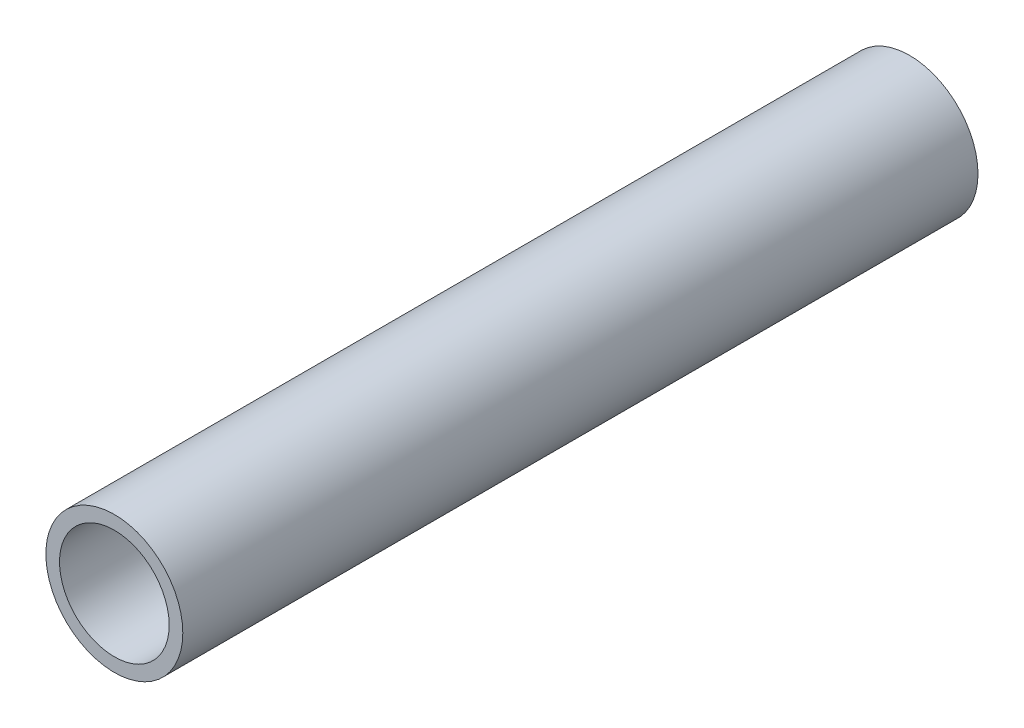
from build123d import *

# Parameters (mm, degrees)
SKETCH1_R           = 15.9385
SKETCH1_R_2         = 12.7635
BOSS_EXTRUDE1_DEPTH = 185.1025


with BuildPart() as part:
    # Sketch1 → Boss-Extrude1 (new body)
    with BuildSketch(Plane.XY):
        Circle(SKETCH1_R)
        Circle(SKETCH1_R_2, mode=Mode.SUBTRACT)
    extrude(amount=BOSS_EXTRUDE1_DEPTH)


solid = part.part
